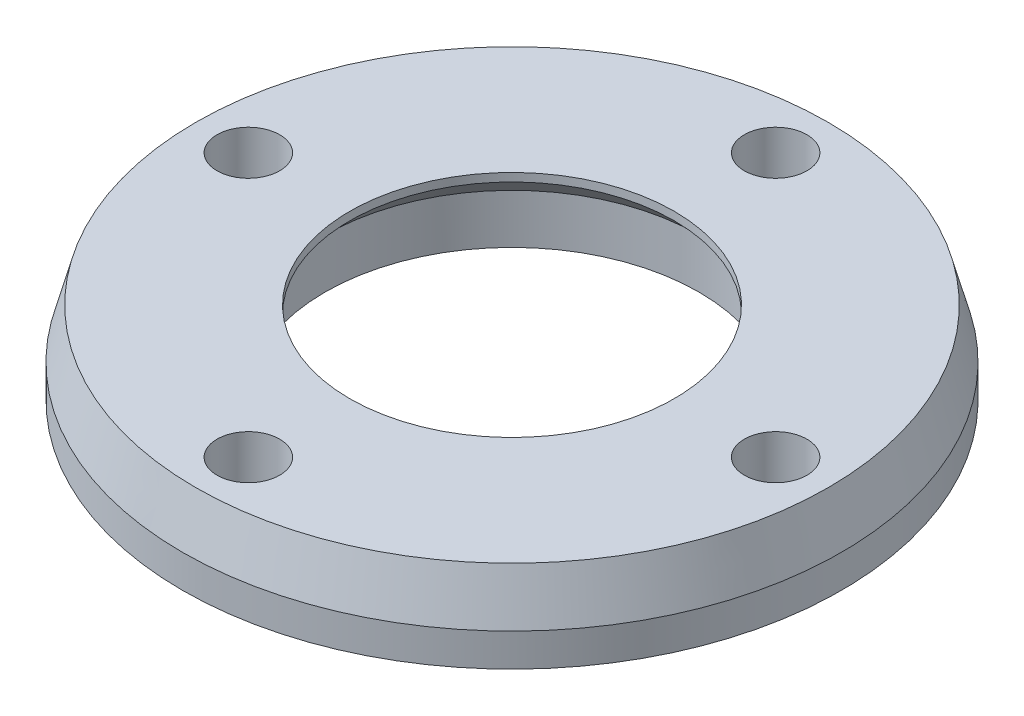
from build123d import *

# Parameters (mm, degrees)
SKETCH1_R           = 20
SKETCH1_R_2         = 11.35
SKETCH1_R_3         = 1.9
BOSS_EXTRUDE1_DEPTH = 5
CHAMFER1_SIZE       = 3
CHAMFER1_SIZE2      = 0.803847577
BOSS_EXTRUDE2_START = -2
SKETCH2_R           = 11.35
SKETCH2_R_2         = 9.85
BOSS_EXTRUDE2_DEPTH = 2
CHAMFER2_SIZE       = 1.5


with BuildPart() as part:
    # Sketch1 → Boss-Extrude1 (new body)
    with BuildSketch(Plane(origin=(0, 0, 0), x_dir=(1, 0, 0), z_dir=(0, 1, 0))):
        with Locations(Location((0, 0, 0), (0, 0, 270))):
            Circle(SKETCH1_R)
        with Locations(Location((0, 0, 0), (0, 0, 270))):
            Circle(SKETCH1_R_2, mode=Mode.SUBTRACT)
        with Locations(Location((0, 16, 0), (0, 0, 270))):
            Circle(SKETCH1_R_3, mode=Mode.SUBTRACT)
        with Locations(Location((16, 0, 0), (0, 0, 270))):
            Circle(SKETCH1_R_3, mode=Mode.SUBTRACT)
        with Locations(Location((0, -16, 0), (0, 0, 270))):
            Circle(SKETCH1_R_3, mode=Mode.SUBTRACT)
        with Locations(Location((-16, 0, 0), (0, 0, 270))):
            Circle(SKETCH1_R_3, mode=Mode.SUBTRACT)
    extrude(amount=BOSS_EXTRUDE1_DEPTH)

    # Chamfer1
    chamfer1_edges = [part.edges().sort_by_distance(p)[0] for p in [
        (0, 5, -20),
    ]]
    chamfer1_side = [part.faces().sort_by_distance(p)[0] for p in [
        (0, 2.5, -20),
    ]]
    chamfer(chamfer1_edges, length=CHAMFER1_SIZE, length2=CHAMFER1_SIZE2, reference=chamfer1_side[0])

    # Sketch2 → Boss-Extrude2 (add)
    with BuildSketch(Plane(origin=(0, 5, 0), x_dir=(1, 0, 0), z_dir=(0, 1, 0)).offset(BOSS_EXTRUDE2_START)):
        with Locations(Location((0, 0, 0), (0, 0, 270))):
            Circle(SKETCH2_R)
        with Locations(Location((0, 0, 0), (0, 0, 270))):
            Circle(SKETCH2_R_2, mode=Mode.SUBTRACT)
    extrude(amount=BOSS_EXTRUDE2_DEPTH)

    # Chamfer2
    chamfer2_edges = [part.edges().sort_by_distance(p)[0] for p in [
        (0, 3, -9.85),
    ]]
    chamfer(chamfer2_edges, length=CHAMFER2_SIZE - 0.0001)  # a hair under: the kernel refuses the full size


solid = part.part
